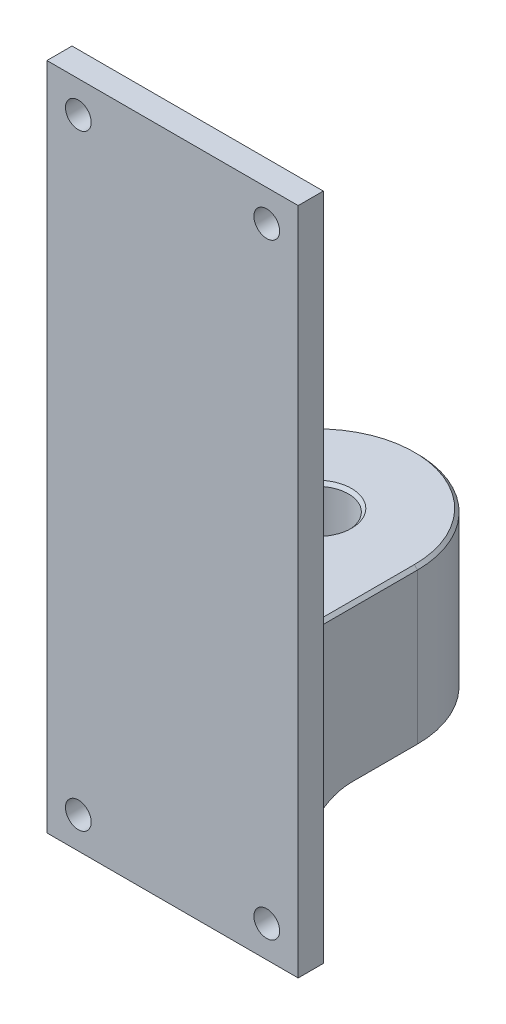
from build123d import *

# Parameters (mm, degrees)
SKETCH1_W                  = 80
SKETCH1_H                  = 213
BOSS_EXTRUDE1_DEPTH        = 10
BOSS_EXTRUDE2_START        = -20
BOSS_EXTRUDE2_DEPTH        = 50
FILLET1_R                  = 15
SKETCH3_R                  = 10
CUT_EXTRUDE1_DEPTH         = 150.084707465
CHAMFER1_SIZE              = 1
F_8_2_8_2_DIAMETER_HOLE1_D = 8.2
CHAMFER2_SIZE              = 2
CHAMFER3_SIZE              = 1
FILLET2_R                  = 1


with BuildPart() as part:
    # Sketch1 → Boss-Extrude1 (new body)
    with BuildSketch(Plane.XY):
        Rectangle(SKETCH1_W, SKETCH1_H)
    extrude(amount=BOSS_EXTRUDE1_DEPTH)

    # Sketch2 → Boss-Extrude2 (add)
    with BuildSketch(Plane(origin=(0, 0, 0), x_dir=(1, 0, 0), z_dir=(0, 1, 0)).offset(BOSS_EXTRUDE2_START)):
        with BuildLine():
            Line((-32, 36), (-32, 0))
            Line((-32, 0), (32, 0))
            Line((32, 0), (32, 36))
            ThreePointArc((32, 36), (0, 68), (-32, 36))
        make_face()
    extrude(amount=-BOSS_EXTRUDE2_DEPTH)

    # Fillet1
    fillet1_edges = [part.edges().sort_by_distance(p)[0] for p in [
        (0, -70, 0),
    ]]
    fillet(fillet1_edges, radius=FILLET1_R)

    # Sketch3 → Cut-Extrude1 (cut, through all)
    with BuildSketch(Plane(origin=(0, -20, 0), x_dir=(1, 0, 0), z_dir=(0, 1, 0))):
        with Locations(Location((0, 36, 0), (0, 0, 270))):
            Circle(SKETCH3_R)
    extrude(amount=-CUT_EXTRUDE1_DEPTH, mode=Mode.SUBTRACT)

    # Chamfer1
    # the kernel refuses this chamfer: 1 mm, written as the material it takes off along each edge
    with BuildSketch(Plane(origin=(0, -70, -36), x_dir=(1, 0, 0), z_dir=(0, 0, 1))) as chamfer1_piece_1:
        Polygon((32 - CHAMFER1_SIZE, 0), (32, CHAMFER1_SIZE), (32, 0), align=None)
    revolve(axis=Axis((0, -70, -36), (0, 1, 0)), revolution_arc=180, mode=Mode.SUBTRACT)
    with BuildSketch(Plane(origin=(-32, -70, -36), x_dir=(-0.027495876610589196, 0.9996219169112968, 0), z_dir=(0, 0, 1)), Plane(origin=(32, -70, -15), x_dir=(0.027495876610589196, 0.9996219169112968, 0), z_dir=(0, 0, -1))) as chamfer1_piece_2:
        Polygon((CHAMFER1_SIZE * 0.999621916911, -CHAMFER1_SIZE * 0.0274958766106), (-CHAMFER1_SIZE * 0.0274958766106, -CHAMFER1_SIZE * 0.999621916911), (0, 0), align=None)
    extrude(amount=21, mode=Mode.SUBTRACT)
    with BuildSketch(Plane(origin=(0, -20, -36), x_dir=(1, 0, 0), z_dir=(0, 0, 1))) as chamfer1_piece_3:
        Polygon((32 - CHAMFER1_SIZE, 0), (32, -CHAMFER1_SIZE), (32, 0), align=None)
    revolve(axis=Axis((0, -20, -36), (0, 1, 0)), revolution_arc=180, mode=Mode.SUBTRACT)
    with BuildSketch(Plane(origin=(-32, -20, -36), x_dir=(-0.0274958766105891, -0.9996219169112968, 0), z_dir=(0, 0, 1)), Plane(origin=(32, -20, 0), x_dir=(0.0274958766105891, -0.9996219169112968, 0), z_dir=(0, 0, -1))) as chamfer1_piece_4:
        Polygon((CHAMFER1_SIZE * 0.999621916911, CHAMFER1_SIZE * 0.0274958766106), (-CHAMFER1_SIZE * 0.0274958766106, CHAMFER1_SIZE * 0.999621916911), (0, 0), align=None)
    extrude(amount=36, mode=Mode.SUBTRACT)
    with BuildSketch(Plane(origin=(32, -85, -15), x_dir=(0, -0.17067472761230248, 0.9853274264702401), z_dir=(0, -0.9853274264702401, -0.17067472761230248))) as chamfer1_piece_5_section:
        Polygon((15, CHAMFER1_SIZE), (15 + CHAMFER1_SIZE, 0), (15, 0), align=None)
    chamfer1_piece_5 = revolve(axis=Axis((32, -85, -15), (-1, 0, 0)), revolution_arc=99.827051452, mode=Mode.PRIVATE)
    chamfer1_piece_5 = split(chamfer1_piece_5, bisect_by=Plane(origin=(31.514748262, -74.050273487, 0), z_dir=(0, 0, -1)), keep=Keep.TOP, mode=Mode.PRIVATE)
    add(chamfer1_piece_5, mode=Mode.SUBTRACT)
    with BuildSketch(Plane(origin=(-32, -85, -15), x_dir=(0, -0.17067472761230248, 0.9853274264702401), z_dir=(0, -0.9853274264702401, -0.17067472761230248))) as chamfer1_piece_6_section:
        Polygon((15 + CHAMFER1_SIZE, 0), (15, -CHAMFER1_SIZE), (15, 0), align=None)
    chamfer1_piece_6 = revolve(axis=Axis((-32, -85, -15), (-1, 0, 0)), revolution_arc=99.827051452, mode=Mode.PRIVATE)
    chamfer1_piece_6 = split(chamfer1_piece_6, bisect_by=Plane(origin=(-31.514748262, -74.050273487, 0), z_dir=(0, 0, -1)), keep=Keep.TOP, mode=Mode.PRIVATE)
    add(chamfer1_piece_6, mode=Mode.SUBTRACT)

    # Ø8.2 (8.2) Diameter Hole1 (through all)
    with Locations(Plane(origin=(0, 0, 0), x_dir=(-1, 0, 0), z_dir=(0, 0, -1))):
        with Locations((30, -96.5), (-30, 96.5), (-30, -96.5), (30, 96.5)):
            Hole(F_8_2_8_2_DIAMETER_HOLE1_D / 2)

    # Chamfer2
    chamfer2_edges = [part.edges().sort_by_distance(p)[0] for p in [
        (0, 106.5, 0),
        (40, 0, 0),
        (0, -106.5, 0),
        (-40, 0, 0),
    ]]
    chamfer(chamfer2_edges, length=CHAMFER2_SIZE)

    # Chamfer3
    chamfer3_edges = [part.edges().sort_by_distance(p)[0] for p in [
        (25.9, -96.5, 0),
        (25.9, 96.5, 0),
        (-34.1, -96.5, 0),
        (0, -70, -46),
        (0, -20, -46),
        (-34.1, 96.5, 0),
    ]]
    chamfer(chamfer3_edges, length=CHAMFER3_SIZE)

    # Fillet2
    fillet2_edges = [part.edges().sort_by_distance(p)[0] for p in [
        (-32, -50.216117819, 0),
        (32, -50.216117819, 0),
        (0, -20, 0),
        (-31.5, -20.5, 0),
        (31.5, -20.5, 0),
    ]]
    fillet(fillet2_edges, radius=FILLET2_R)


solid = part.part
